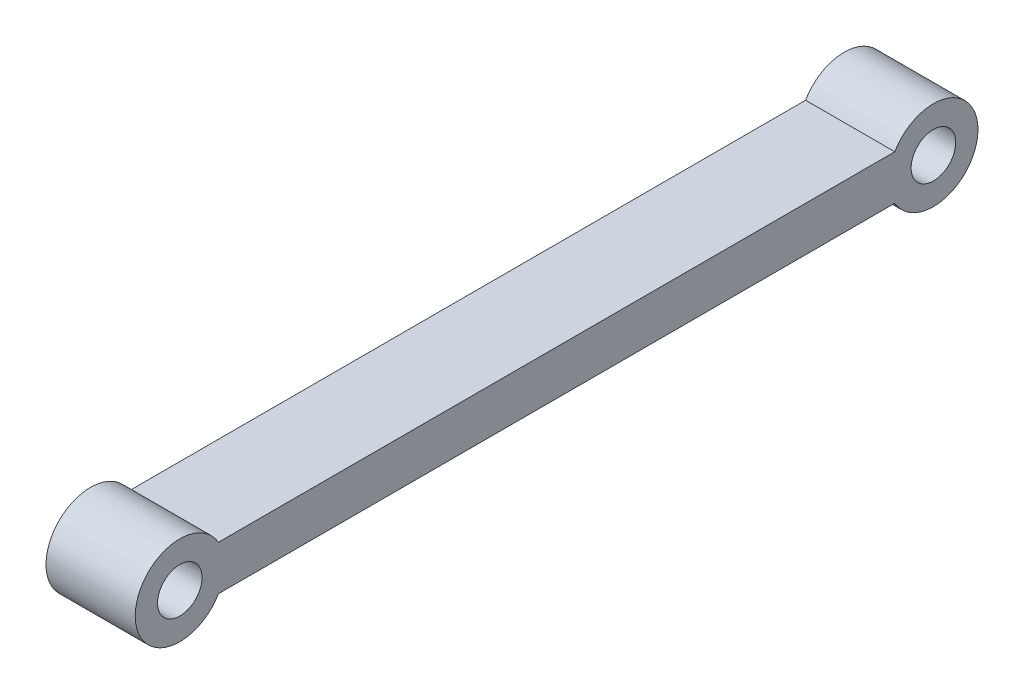
from build123d import *

# Parameters (mm, degrees)
SKETCH1_R           = 1
BOSS_EXTRUDE1_DEPTH = 2


with BuildPart() as part:
    # Sketch1 → Boss-Extrude1 (new, symmetric)
    with BuildSketch(Plane(origin=(0, 0, 0), x_dir=(0, 0, -1), z_dir=(1, 0, 0))):
        with BuildLine():
            Line((-15.162949192, -2), (15.162949192, -2))
            ThreePointArc((15.162949192, -2), (18.895, -1), (15.162949192, 0))
            Line((15.162949192, 0), (-15.162949192, 0))
            ThreePointArc((-15.162949192, 0), (-18.895, -1), (-15.162949192, -2))
        make_face()
        with Locations((-16.895, -1)):
            Circle(SKETCH1_R, mode=Mode.SUBTRACT)
        with Locations((16.895, -1)):
            Circle(SKETCH1_R, mode=Mode.SUBTRACT)
    extrude(amount=BOSS_EXTRUDE1_DEPTH, both=True)


solid = part.part
